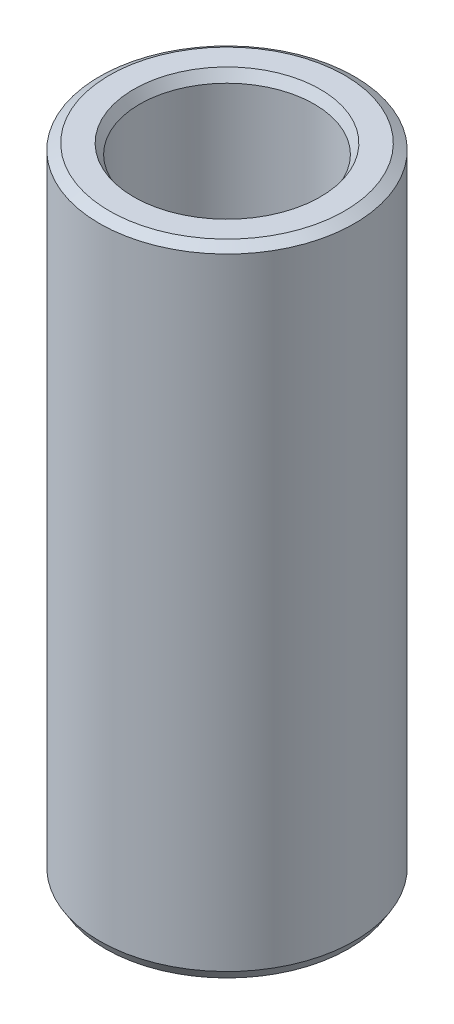
from build123d import *
from OCP.BRepFilletAPI import BRepFilletAPI_MakeChamfer

# Parameters (mm, degrees)
SKETCH1_R           = 45
BOSS_EXTRUDE1_DEPTH = 224.977429233
SKETCH2_R           = 30.81552754
CUT_EXTRUDE1_DEPTH  = 234.805140371
CHAMFER1_SIZE       = 2.119822081
CHAMFER1_SIZE2      = 3.47307752


with BuildPart() as part:
    # Sketch1 → Boss-Extrude1 (new body)
    with BuildSketch(Plane(origin=(0, 0, 0), x_dir=(1, 0, 0), z_dir=(0, 1, 0))):
        Circle(SKETCH1_R)
    extrude(amount=BOSS_EXTRUDE1_DEPTH)

    # Sketch2 → Cut-Extrude1 (cut, through all)
    with BuildSketch(Plane(origin=(0, 0, 0), x_dir=(1, 0, 0), z_dir=(0, 1, 0))):
        Circle(SKETCH2_R)
    extrude(amount=CUT_EXTRUDE1_DEPTH, mode=Mode.SUBTRACT)

    # Chamfer1: one chamfer whose edges measure the first distance from different faces: ONE call of the kernel's chamfer builder (chamfer() names one face for all edges)
    chamfer1_edges_1 = [part.edges().sort_by_distance(p)[0] for p in [
        (-30.81552754, 224.977429233, 0),
    ]]
    chamfer1_side_1 = [part.faces().sort_by_distance(p)[0] for p in [
        (-43.727207794, 224.977429233, 0),
    ]]
    chamfer1_edges_2 = [part.edges().sort_by_distance(p)[0] for p in [
        (-30.81552754, 0, 0),
    ]]
    chamfer1_side_2 = [part.faces().sort_by_distance(p)[0] for p in [
        (-30.81552754, 112.488714616, 0),
    ]]
    chamfer1_edges_3 = [part.edges().sort_by_distance(p)[0] for p in [
        (-45, 0, 0),
    ]]
    chamfer1_side_3 = [part.faces().sort_by_distance(p)[0] for p in [
        (-43.727207794, 0, 0),
    ]]
    chamfer1_edges_4 = [part.edges().sort_by_distance(p)[0] for p in [
        (-45, 224.977429233, 0),
    ]]
    chamfer1_side_4 = [part.faces().sort_by_distance(p)[0] for p in [
        (-45, 112.488714616, 0),
    ]]
    chamfer1 = BRepFilletAPI_MakeChamfer(part.part.solid().wrapped)
    for e in chamfer1_edges_1:
        chamfer1.Add(CHAMFER1_SIZE, CHAMFER1_SIZE2, e.wrapped, chamfer1_side_1[0].wrapped)  # the first distance lies on this face
    for e in chamfer1_edges_2:
        chamfer1.Add(CHAMFER1_SIZE, CHAMFER1_SIZE2, e.wrapped, chamfer1_side_2[0].wrapped)  # the first distance lies on this face
    for e in chamfer1_edges_3:
        chamfer1.Add(CHAMFER1_SIZE, CHAMFER1_SIZE2, e.wrapped, chamfer1_side_3[0].wrapped)  # the first distance lies on this face
    for e in chamfer1_edges_4:
        chamfer1.Add(CHAMFER1_SIZE, CHAMFER1_SIZE2, e.wrapped, chamfer1_side_4[0].wrapped)  # the first distance lies on this face
    add(Compound.cast(chamfer1.Shape()), mode=Mode.REPLACE)


solid = part.part
